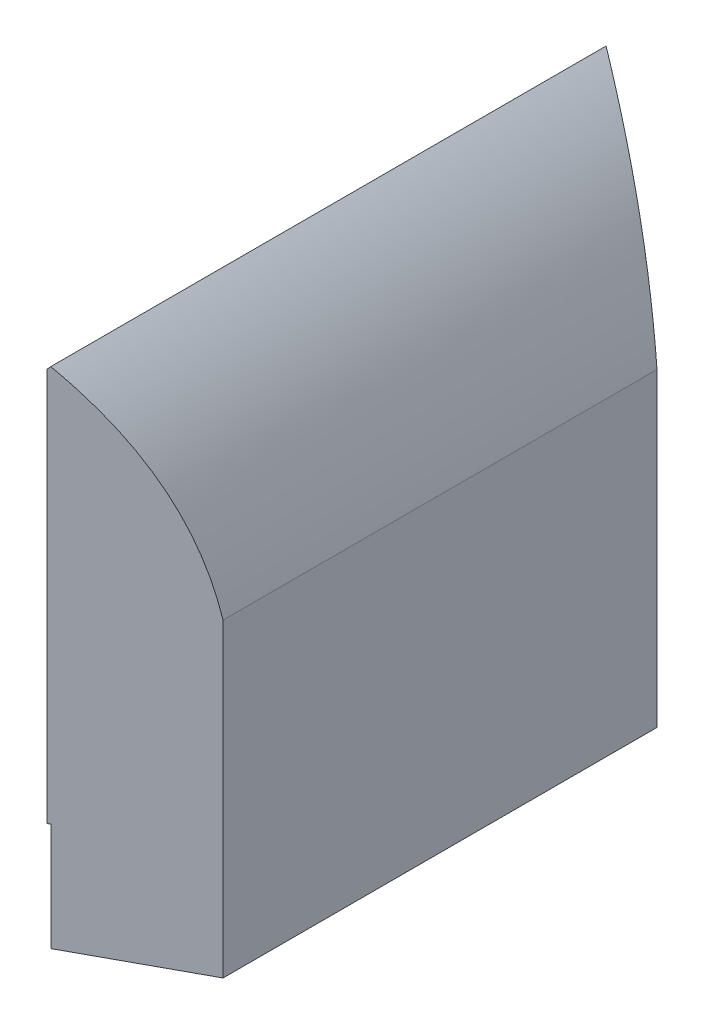
from build123d import *

# Parameters (mm, degrees)
BOSS_EXTRUDE1_DEPTH             = 450
CUT_EXTRUDE1_DEPTH              = 560.198855425
CUT_EXTRUDE1_DEPTH_BACK         = 560.198855425
BOSS_EXTRUDE2_REACH             = 561.199
BOSS_EXTRUDE2_DIRECTION_2_REACH = 561.199


with BuildPart() as part:
    # Sketch1 → Boss-Extrude1 (new body)
    with BuildSketch(Plane.XY):
        with BuildLine():
            Line((0, 0), (0, -86.95))
            Line((0, -86.95), (90, -86.95))
            Line((90, -86.95), (90, 163.05))
            add(Edge.make_bspline(
                [(90, 163.05), (72.317416943, 256.499426115), (1.7e-06, 319.536163425)],
                knots=[0, 0, 0, 1, 1, 1], degree=2))
            Line((1.7e-06, 319.536163425), (-1.971240178, 317.274702513))
            add(Edge.make_bspline(
                [(87, 162.76796294), (86.63530579, 164.685544789), (85.866737034, 168.522541651), (84.193801862, 176.09415534), (81.838470508, 185.417428941), (78.592614297, 196.364076295), (73.704594381, 210.644362496), (66.544776494, 227.902696365), (56.272326819, 247.671791898), (44.316806262, 266.505130738), (32.948415938, 281.423453125), (23.007866651, 292.89431167), (15.129804099, 301.265055213), (8.209142943, 308.04969842), (2.465529724, 313.357146881), (-0.486511784, 315.980513091), (-1.971240178, 317.274702513)],
                knots=[0.001490309, 0.001490309, 0.001490309, 0.001490309, 0.032693737, 0.063897165, 0.12630402, 0.188710876, 0.251117732, 0.375931443, 0.500745154, 0.625558866, 0.750372577, 0.812779433, 0.875186289, 0.937593144, 0.968796572, 1, 1, 1, 1], degree=3))
            Line((87, 162.76796294), (87, -83.95))
            Line((87, -83.95), (3, -83.95))
            Line((3, -83.95), (3, 0))
            Line((3, 0), (0, 0))
        make_face()
    extrude(amount=BOSS_EXTRUDE1_DEPTH)

    # Sketch2 → Cut-Extrude1 (cut, two sides: drawn at the far end of the back side and taken through both)
    with BuildSketch(Plane(origin=(0, 0, 0), x_dir=(1, 0, 0), z_dir=(0, 1, 0)).offset(-CUT_EXTRUDE1_DEPTH_BACK)):
        Polygon((-1.971240178, -450), (90, -400), (90, -450), align=None)
        Polygon((90, 0), (90, -50), (-1.971240178, 0), align=None)
    extrude(amount=CUT_EXTRUDE1_DEPTH + CUT_EXTRUDE1_DEPTH_BACK, mode=Mode.SUBTRACT)

    # Sketch3 → Boss-Extrude2 (add, up to next)
    with BuildSketch(Plane(origin=(0, 0, 0), x_dir=(1, 0, 0), z_dir=(0, 1, 0)), mode=Mode.PRIVATE) as boss_extrude2_sk1:
        Polygon((-1.971240178, -446), (90, -396), (90, -400), (-1.971240178, -450), align=None)
    boss_extrude2_tool1 = extrude(boss_extrude2_sk1.sketch, amount=BOSS_EXTRUDE2_REACH, mode=Mode.PRIVATE) - part.part
    # Sketch3 → Boss-Extrude2 (add, up to next)
    with BuildSketch(Plane(origin=(0, 0, 0), x_dir=(1, 0, 0), z_dir=(0, 1, 0)), mode=Mode.PRIVATE) as boss_extrude2_sk2:
        Polygon((-1.971240178, -4), (-1.971240178, 0), (90, -50), (90, -54), align=None)
    boss_extrude2_tool2 = extrude(boss_extrude2_sk2.sketch, amount=BOSS_EXTRUDE2_REACH, mode=Mode.PRIVATE) - part.part
    add(boss_extrude2_tool1.solids().sort_by_distance((44.01438, 0, 423))[0])
    add(boss_extrude2_tool2.solids().sort_by_distance((44.01438, 0, 27))[0])

    # Sketch3 → Boss-Extrude2 direction 2 (add, up to next)
    with BuildSketch(Plane(origin=(0, 0, 0), x_dir=(1, 0, 0), z_dir=(0, 1, 0)), mode=Mode.PRIVATE) as boss_extrude2_direction_2_sk1:
        Polygon((-1.971240178, -446), (90, -396), (90, -400), (-1.971240178, -450), align=None)
    boss_extrude2_direction_2_tool1 = extrude(boss_extrude2_direction_2_sk1.sketch, amount=-BOSS_EXTRUDE2_DIRECTION_2_REACH, mode=Mode.PRIVATE) - part.part
    # Sketch3 → Boss-Extrude2 direction 2 (add, up to next)
    with BuildSketch(Plane(origin=(0, 0, 0), x_dir=(1, 0, 0), z_dir=(0, 1, 0)), mode=Mode.PRIVATE) as boss_extrude2_direction_2_sk2:
        Polygon((-1.971240178, -4), (-1.971240178, 0), (90, -50), (90, -54), align=None)
    boss_extrude2_direction_2_tool2 = extrude(boss_extrude2_direction_2_sk2.sketch, amount=-BOSS_EXTRUDE2_DIRECTION_2_REACH, mode=Mode.PRIVATE) - part.part
    add(boss_extrude2_direction_2_tool1.solids().sort_by_distance((44.01438, 0, 423))[0])
    add(boss_extrude2_direction_2_tool2.solids().sort_by_distance((44.01438, 0, 27))[0])


solid = part.part
